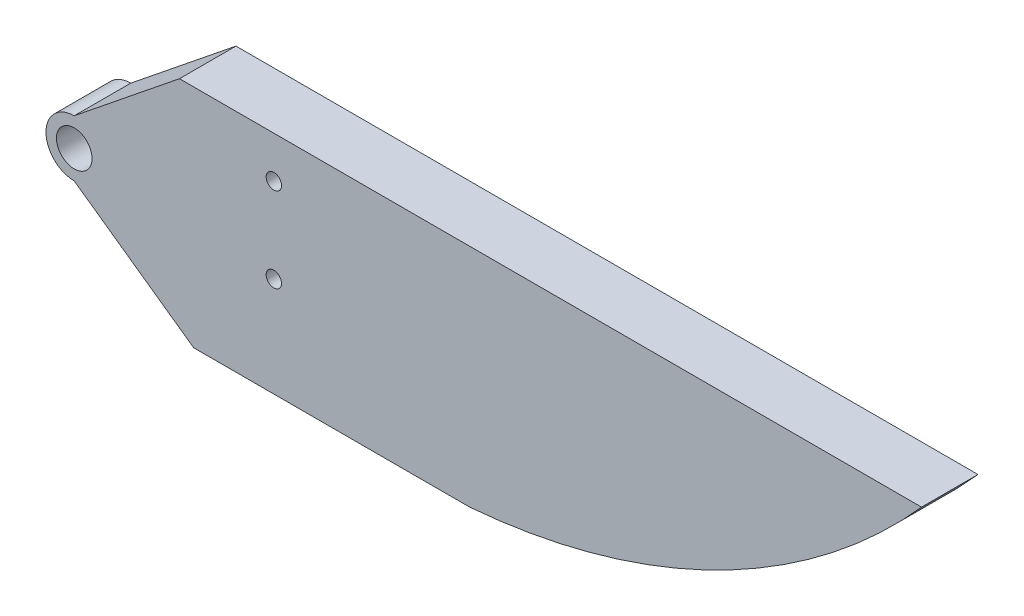
from build123d import *

# Parameters (mm, degrees)
SKETCH1_W                 = 203.2
SKETCH1_H                 = 50.8
BOSS_EXTRUDE1_DEPTH       = 12.7
SKETCH3_R                 = 4
CUT_EXTRUDE1_DEPTH        = 106.494123059
CUT_EXTRUDE2_DEPTH        = 106.494123059
TAP_DRILL_FOR_8_32_TAP1_D = 3.4544


with BuildPart() as part:
    # Sketch1 → Boss-Extrude1 (new body)
    with BuildSketch(Plane.XY):
        Rectangle(SKETCH1_W, SKETCH1_H)
    extrude(amount=BOSS_EXTRUDE1_DEPTH)

    # Sketch3 → Cut-Extrude1 (cut, through all)
    with BuildSketch(Plane.XY.offset(12.7)):
        with Locations((-88.9, 0)):
            Circle(SKETCH3_R)
    extrude(amount=-CUT_EXTRUDE1_DEPTH, mode=Mode.SUBTRACT)

    # Sketch5 → Cut-Extrude2 (cut, through all)
    with BuildSketch(Plane.XY.offset(12.7)):
        with BuildLine():
            Line((-88.9, -6.35), (-62.046109456, -25.4))
            Line((-62.046109456, -25.4), (-101.6, -25.4))
            Line((-101.6, -25.4), (-101.6, 25.4))
            Line((-101.6, 25.4), (-65.239311186, 25.4))
            Line((-65.239311186, 25.4), (-88.9, 6.35))
            ThreePointArc((-88.9, 6.35), (-95.25, 0), (-88.9, -6.35))
        make_face()
        with BuildLine():
            Line((101.6, 25.4), (101.6, -25.4))
            Line((101.6, -25.4), (0, -25.4))
            ThreePointArc((0, -25.4), (55.709861996, -9.819723993), (101.6, 25.4))
        make_face()
    extrude(amount=-CUT_EXTRUDE2_DEPTH, mode=Mode.SUBTRACT)

    # Tap Drill for #8-32 Tap1 (through all)
    with Locations(Plane(origin=(0, 0, 0), x_dir=(-1, 0, 0), z_dir=(0, 0, -1))):
        with Locations((44.020428639, 16.052306877), (44.020428639, -2.997693123)):
            Hole(TAP_DRILL_FOR_8_32_TAP1_D / 2)


solid = part.part
